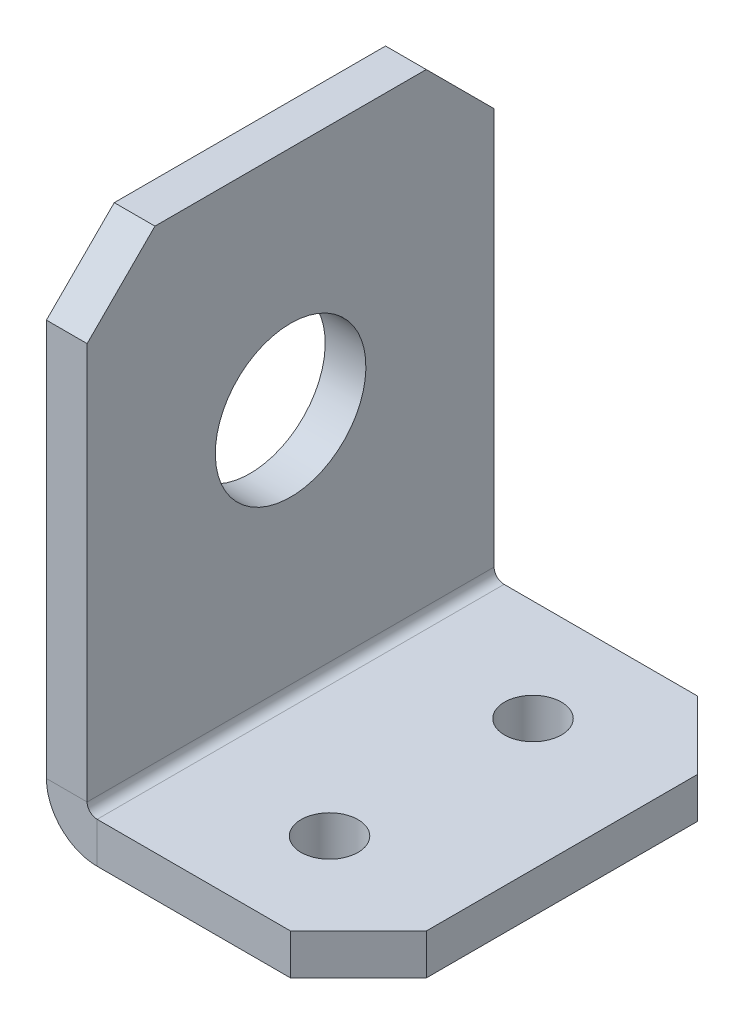
from build123d import *

# Parameters (mm, degrees)
SM_BASE_FLANGE_1_DEPTH = 30
CUT_EXTRUDE_1_REACH    = 43.476
SKETCH_6_R             = 5.55
CUT_EXTRUDE_2_REACH    = 49.896
SKETCH_7_R             = 2.1
CHAMFER_1_SIZE         = 5


# Sheet-metal steps are written as plain solids
with BuildPart() as part:
    # Sketch 1 → 基材-凸緣1 (new body)
    with BuildSketch(Plane.XY):
        with BuildLine():
            Line((-10, 17.5), (-10, -16.7634))
            ThreePointArc((-10, -16.7634), (-9.784254855, -17.284254855), (-9.2634, -17.5))
            Line((-9.2634, -17.5), (10, -17.5))
            Line((10, -17.5), (10, -20.5))
            Line((10, -20.5), (-9.2634, -20.5))
            ThreePointArc((-9.2634, -20.5), (-11.905575199, -19.405575199), (-13, -16.7634))
            Line((-13, -16.7634), (-13, 17.5))
            Line((-13, 17.5), (-10, 17.5))
        make_face()
    extrude(amount=SM_BASE_FLANGE_1_DEPTH)

    # 草圖6 → 除料-伸長1 (cut, up to next)
    with BuildSketch(Plane(origin=(-10, 0, 0), x_dir=(0, 0, -1), z_dir=(1, 0, 0)), mode=Mode.PRIVATE) as cut_extrude_1_sk1:
        with Locations(Location((-15, 0.75, 0), (0, 0, 90))):
            Circle(SKETCH_6_R)
    cut_extrude_1_tool1 = extrude(cut_extrude_1_sk1.sketch, amount=-CUT_EXTRUDE_1_REACH, mode=Mode.PRIVATE) & part.part
    add(cut_extrude_1_tool1.solids().sort_by_distance((-10, 0.75, 15))[0], mode=Mode.SUBTRACT)

    # 草圖7 → 除料-伸長2 (cut, up to next)
    with BuildSketch(Plane(origin=(0, -17.5, 0), x_dir=(1, 0, 0), z_dir=(0, 1, 0)), mode=Mode.PRIVATE) as cut_extrude_2_sk1:
        with Locations(Location((0.3683, -22.5, 0), (0, 0, 270))):
            Circle(SKETCH_7_R)
    cut_extrude_2_tool1 = extrude(cut_extrude_2_sk1.sketch, amount=-CUT_EXTRUDE_2_REACH, mode=Mode.PRIVATE) & part.part
    # 草圖7 → 除料-伸長2 (cut, up to next)
    with BuildSketch(Plane(origin=(0, -17.5, 0), x_dir=(1, 0, 0), z_dir=(0, 1, 0)), mode=Mode.PRIVATE) as cut_extrude_2_sk2:
        with Locations(Location((0.3683, -7.5, 0), (0, 0, 270))):
            Circle(SKETCH_7_R)
    cut_extrude_2_tool2 = extrude(cut_extrude_2_sk2.sketch, amount=-CUT_EXTRUDE_2_REACH, mode=Mode.PRIVATE) & part.part
    add(cut_extrude_2_tool1.solids().sort_by_distance((0.3683, -17.5, 22.5))[0], mode=Mode.SUBTRACT)
    add(cut_extrude_2_tool2.solids().sort_by_distance((0.3683, -17.5, 7.5))[0], mode=Mode.SUBTRACT)

    # 導角1
    chamfer_1_edges = [part.edges().sort_by_distance(p)[0] for p in [
        (-11.5, 17.5, 30),
        (-11.5, 17.5, 0),
        (10, -19, 30),
        (10, -19, 0),
    ]]
    chamfer(chamfer_1_edges, length=CHAMFER_1_SIZE)


solid = part.part
